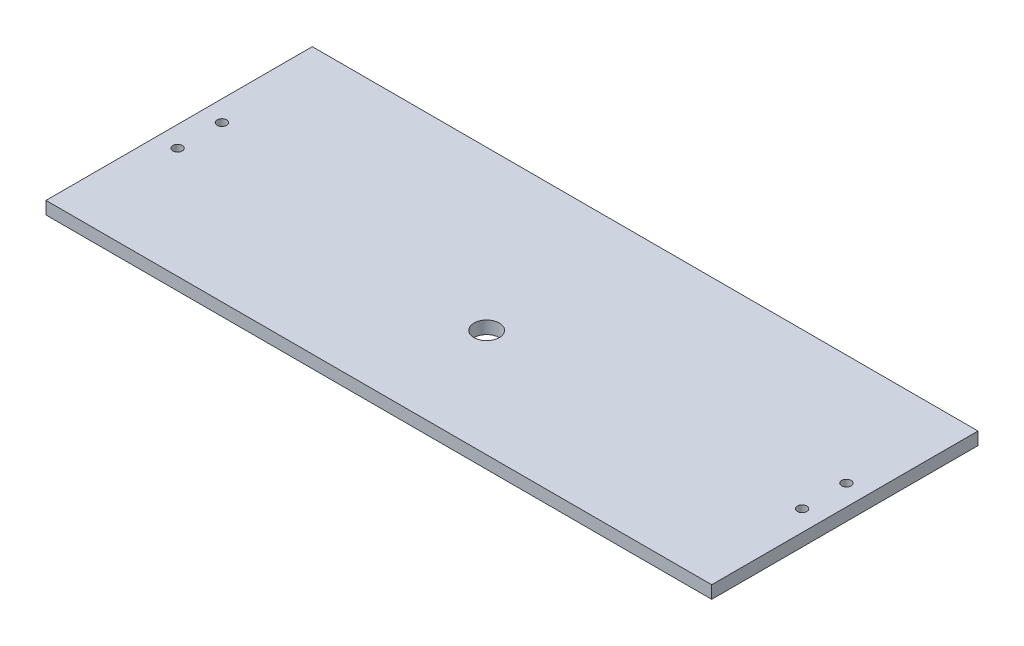
from build123d import *

# Parameters (mm, degrees)
CROQUIS2_W              = 210
CROQUIS2_H              = 84
CROQUIS2_R              = 4
CROQUIS2_R_2            = 1.5
SALIENTE_EXTRUIR1_DEPTH = 4


with BuildPart() as part:
    # Croquis2 → Saliente-Extruir1 (new body)
    with BuildSketch(Plane(origin=(-13.73192422, 703.628389678, -26.324312824), x_dir=(-1, 0, 0), z_dir=(0, -1, 0))):
        with Locations((-28.230309316, 14.115154658)):
            Rectangle(CROQUIS2_W, CROQUIS2_H)
        with Locations((-28.230309316, 6.115154658)):
            Circle(CROQUIS2_R, mode=Mode.SUBTRACT)
        with Locations((-126.730309316, 7.115154658)):
            Circle(CROQUIS2_R_2, mode=Mode.SUBTRACT)
        with Locations((-126.730309316, 21.115154658)):
            Circle(CROQUIS2_R_2, mode=Mode.SUBTRACT)
        with Locations((70.269690684, 21.115154658)):
            Circle(CROQUIS2_R_2, mode=Mode.SUBTRACT)
        with Locations((70.269690684, 7.115154658)):
            Circle(CROQUIS2_R_2, mode=Mode.SUBTRACT)
    extrude(amount=-SALIENTE_EXTRUIR1_DEPTH)


solid = part.part
